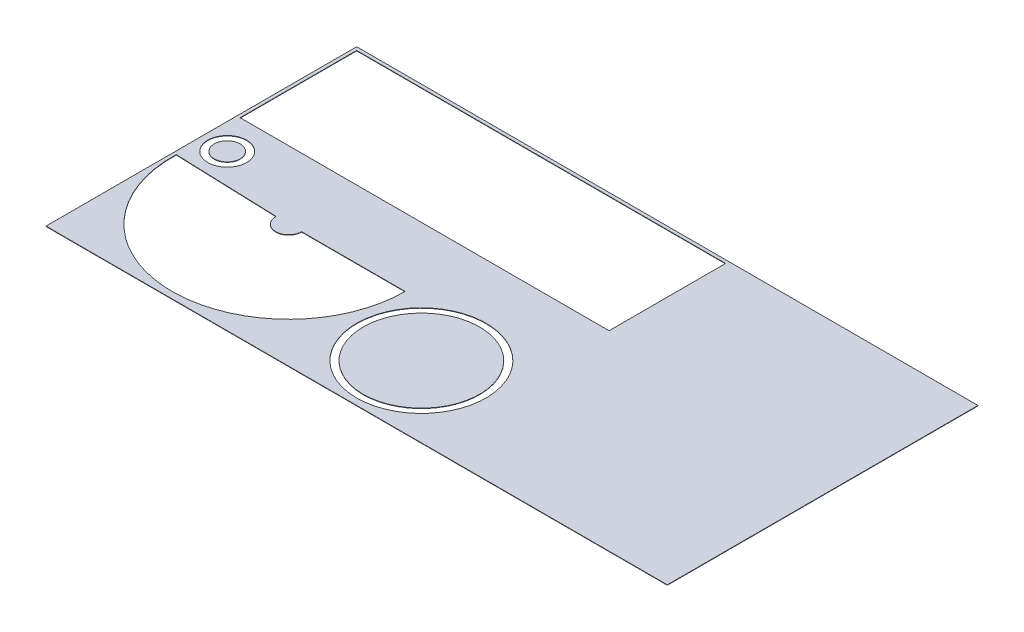
from build123d import *

# Parameters (mm, degrees)
SKETCH1_W          = 2438.4
SKETCH1_H          = 1219.2
BASE_FLANGE1_DEPTH = 1.5875
SKETCH6_R          = 254
SKETCH6_R_2        = 228.6
SKETCH6_R_3        = 76.2
SKETCH6_R_4        = 50.8
SKETCH6_W          = 1447.8
SKETCH6_H          = 457.2
CUT_EXTRUDE3_DEPTH = 1364.1079635


# Sheet-metal steps are written as plain solids
with BuildPart() as part:
    # Sketch1 → Base-Flange1 (new body)
    with BuildSketch(Plane(origin=(0, 0, 0), x_dir=(1, 0, 0), z_dir=(0, 1, 0))):
        Rectangle(SKETCH1_W, SKETCH1_H)
    extrude(amount=-BASE_FLANGE1_DEPTH)

    # Sketch6 → Cut-Extrude3 (cut, through all)
    # profile 1 of 4: a face of its own
    with BuildSketch(Plane(origin=(0, 0, 0), x_dir=(1, 0, 0), z_dir=(0, 1, 0))):
        with Locations(Location((-25.4, -330.2, 0), (0, 0, 270))):
            Circle(SKETCH6_R)
        with Locations(Location((-25.4, -330.2, 0), (0, 0, 270))):
            Circle(SKETCH6_R_2, mode=Mode.SUBTRACT)
    # profile 2 of 4: a face of its own
    with BuildSketch(Plane(origin=(0, 0, 0), x_dir=(1, 0, 0), z_dir=(0, 1, 0))):
        with Locations(Location((-1117.6, 0, 0), (0, 0, 270))):
            Circle(SKETCH6_R_3)
        with Locations(Location((-1117.6, 0, 0), (0, 0, 270))):
            Circle(SKETCH6_R_4, mode=Mode.SUBTRACT)
    # profile 3 of 4: a face of its own
    with BuildSketch(Plane(origin=(0, 0, 0), x_dir=(1, 0, 0), z_dir=(0, 1, 0))):
        with Locations((-482.6, 368.3)):
            Rectangle(SKETCH6_W, SKETCH6_H)
    # profile 4 of 4: a face of its own
    with BuildSketch(Plane(origin=(0, 0, 0), x_dir=(1, 0, 0), z_dir=(0, 1, 0))):
        with BuildLine():
            Line((-698.778513887, -127), (-292.378513887, -127))
            ThreePointArc((-292.378513887, -127), (-757.55775411, -584.130366226), (-1206.5, -111.043950108))
            Line((-1206.5, -111.043950108), (-800.347567899, -125.227105568))
            ThreePointArc((-800.347567899, -125.227105568), (-750.465096134, -177.792262914), (-698.778513887, -127))
        make_face()
    extrude(amount=-CUT_EXTRUDE3_DEPTH, mode=Mode.SUBTRACT)


with BuildPart() as cut_extrude3_piece_1:
    # of the separate pieces the step leaves, piece 1, a body of its own (cut_extrude3_pieces)
    add(part.part.solids().sort_by_distance((-1219.2, 0, 609.6))[0])


with BuildPart() as cut_extrude3_piece_2:
    # of the separate pieces the step leaves, piece 2, a body of its own (cut_extrude3_pieces)
    add(part.part.solids().sort_by_distance((-25.4, 0, 558.8))[0])


with BuildPart() as cut_extrude3_piece_3:
    # of the separate pieces the step leaves, piece 3, a body of its own (cut_extrude3_pieces)
    add(part.part.solids().sort_by_distance((-1117.6, 0, 50.8))[0])


solid = Compound([cut_extrude3_piece_1.part, cut_extrude3_piece_2.part, cut_extrude3_piece_3.part])
